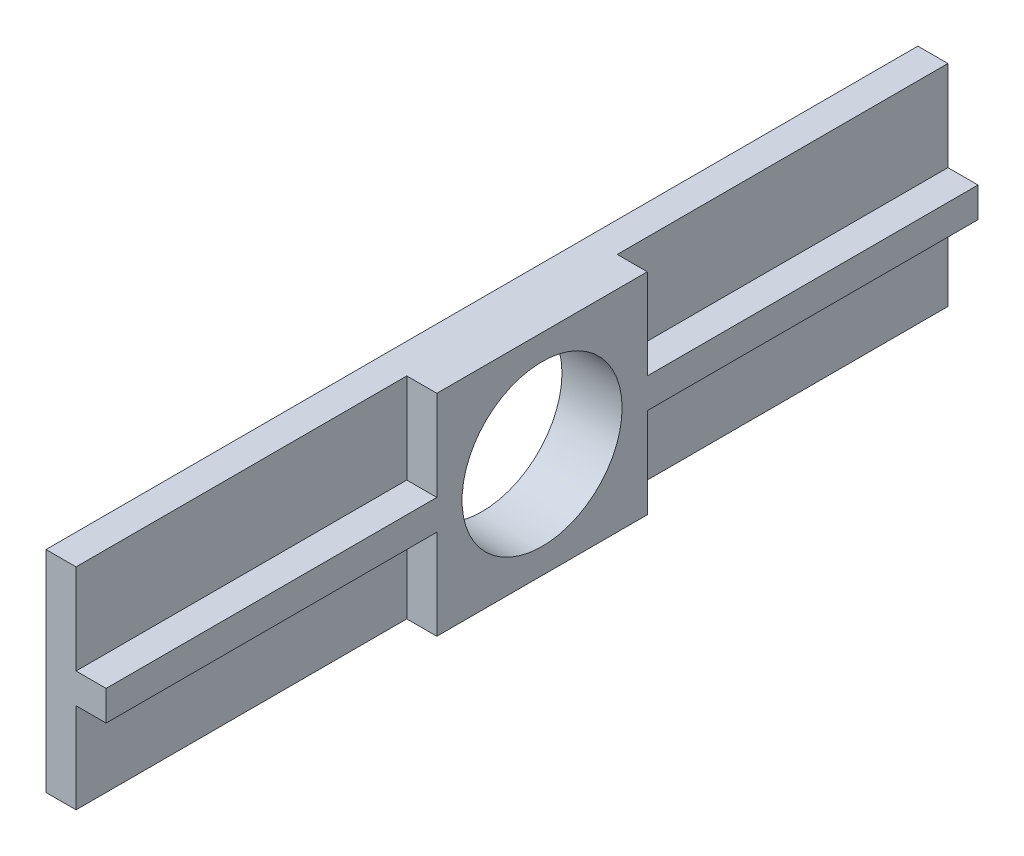
from build123d import *

# Parameters (mm, degrees)
SKETCH2_R           = 16.9037
BOSS_EXTRUDE1_DEPTH = 6.35
BOSS_EXTRUDE2_START = -6.35
SKETCH2_3_W         = 184.15
SKETCH2_3_H         = 44.45
SKETCH2_3_R         = 16.9037
BOSS_EXTRUDE2_DEPTH = 6.35


with BuildPart() as part:
    # Sketch2 → Boss-Extrude1 (new body)
    with BuildSketch(Plane(origin=(0, 0, 0), x_dir=(0, 0, -1), z_dir=(1, 0, 0))):
        Polygon((-22.225, -3.175), (-22.225, -22.225), (22.225, -22.225), (22.225, -3.175), (92.075, -3.175), (92.075, 3.175), (22.225, 3.175), (22.225, 22.225), (-22.225, 22.225), (-22.225, 3.175), (-92.075, 3.175), (-92.075, -3.175), align=None)
        Circle(SKETCH2_R, mode=Mode.SUBTRACT)
    extrude(amount=BOSS_EXTRUDE1_DEPTH)

    # Sketch2<3> → Boss-Extrude2 (add)
    with BuildSketch(Plane(origin=(0, 0, 0), x_dir=(0, 0, -1), z_dir=(1, 0, 0)).offset(BOSS_EXTRUDE2_START)):
        Rectangle(SKETCH2_3_W, SKETCH2_3_H)
        Circle(SKETCH2_3_R, mode=Mode.SUBTRACT)
    extrude(amount=BOSS_EXTRUDE2_DEPTH)


solid = part.part
